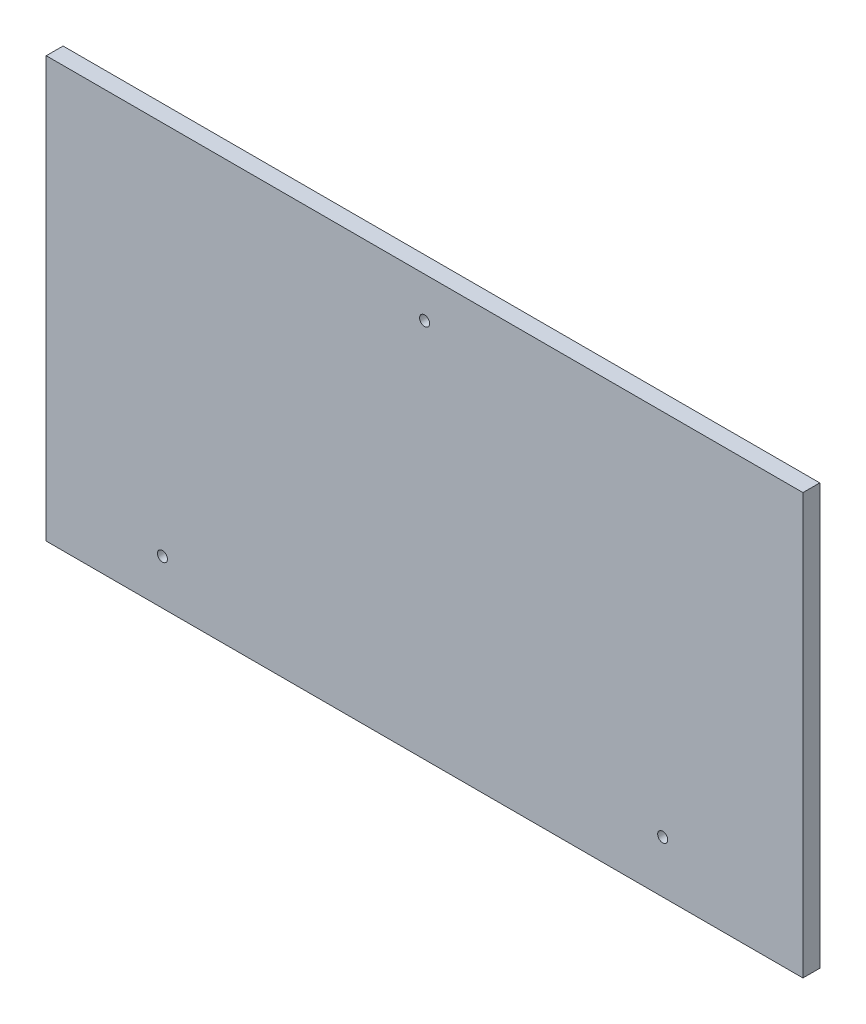
from build123d import *

# Parameters (mm, degrees)
SKIZZE1_W                       = 450
SKIZZE1_H                       = 250
AUFSATZ_LINEAR_AUSTRAGEN1_DEPTH = 10
F_6_0_6_DURCHMESSER_BOHRUNG1_D  = 6


with BuildPart() as part:
    # Skizze1 → Aufsatz-Linear austragen1 (new body)
    with BuildSketch(Plane.XY):
        Rectangle(SKIZZE1_W, SKIZZE1_H)
    extrude(amount=AUFSATZ_LINEAR_AUSTRAGEN1_DEPTH)

    # Ø6.0 (6) Durchmesser Bohrung1 (through all)
    with Locations(Plane(origin=(-155.90714354, -98.249176254, 0), x_dir=(-1, 0, 0), z_dir=(0, 0, -1))):
        with Locations((0, 0), (-297.515111193, 4.151373644), (-155.90714354, 199.265934938)):
            Hole(F_6_0_6_DURCHMESSER_BOHRUNG1_D / 2)


solid = part.part
